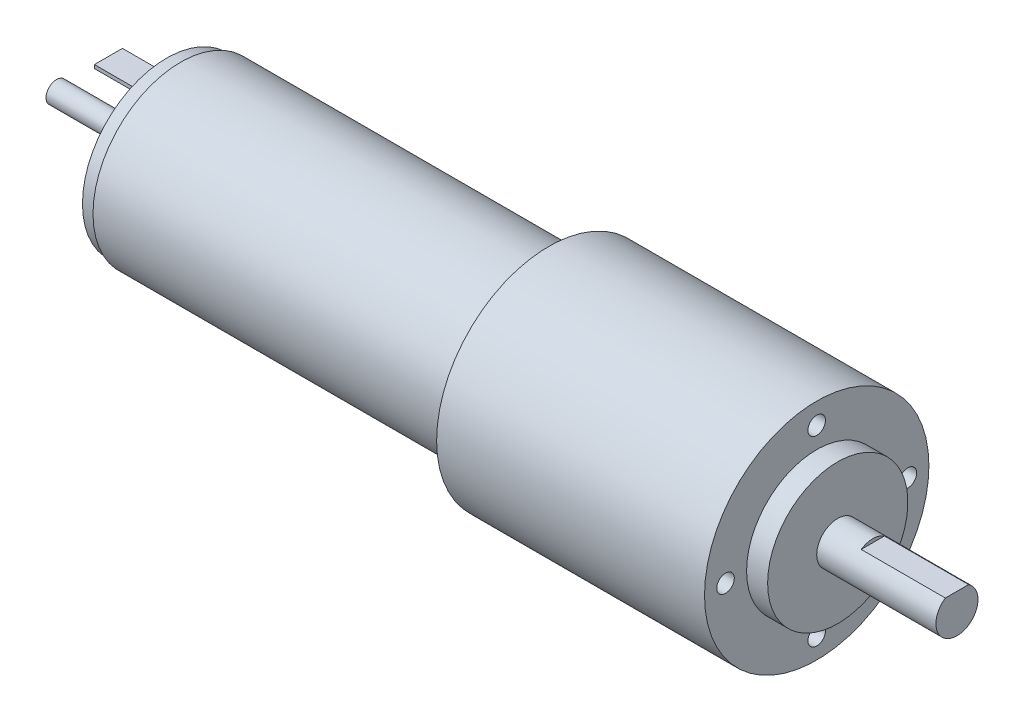
from build123d import *

# Parameters (mm, degrees)
ESQUISSE2_W                  = 4
ESQUISSE2_H                  = 0.5
EXTRUSION1_DEPTH             = 8.3
R_P_TITION_CIRCULAIRE1_COUNT = 2
ENL_V_MAT_EXTRU_1_DEPTH      = 131.378525839
ENL_V_MAT_EXTRU_1_DEPTH_BACK = 131.378525839
ESQUISSE3_W                  = 12
ESQUISSE3_H                  = 0.5


# Read off the part's stored shape, not the designer's step: Répétition circulaire2
with BuildPart() as part:
    # Esquisse1 → Révolution1 (revolve)
    with BuildSketch(Plane.XY, mode=Mode.PRIVATE) as r_volution1_sk:
        Polygon((0, 0), (0, 1.5), (15.7, 1.5), (15.7, 12), (17.7, 12), (17.7, 12.5), (70.2, 12.5), (70.2, 16), (108.4, 16), (108.4, 10), (111.4, 10), (111.4, 3), (128.4, 3), (128.4, 0), align=None)
    revolve(r_volution1_sk.sketch.rotate(Axis((-1000, 0, 0), (1, 0, 0)), 90), axis=Axis((-1000, 0, 0), (1, 0, 0)))

    # Esquisse2 → Extrusion1 (add)
    with BuildSketch(Plane.ZY.offset(-15.7)):
        with Locations((0, -7.8)):
            Rectangle(ESQUISSE2_W, ESQUISSE2_H)
    extrusion1 = extrude(amount=EXTRUSION1_DEPTH)

    # Répétition circulaire1: Extrusion1 ×2 about axis
    r_p_tition_circulaire1_axis = Axis((0, 0, 0), (1, 0, 0))
    for i in range(1, R_P_TITION_CIRCULAIRE1_COUNT):
        add(extrusion1.rotate(r_p_tition_circulaire1_axis, i * 360 / R_P_TITION_CIRCULAIRE1_COUNT))

    # Esquisse3 → Enlèv. mat.-Extru.1 (cut, two sides: drawn at the far end of the back side and taken through both)
    with BuildSketch(Plane.XY.offset(-ENL_V_MAT_EXTRU_1_DEPTH_BACK)):
        with Locations((122.4, 2.75)):
            Rectangle(ESQUISSE3_W, ESQUISSE3_H)
    extrude(amount=ENL_V_MAT_EXTRU_1_DEPTH + ENL_V_MAT_EXTRU_1_DEPTH_BACK, mode=Mode.SUBTRACT)

    # Esquisse5 → Trou taraudé M3x0.51 (revolve, cut)
    with BuildSketch(Plane(origin=(108.4, 13, 0), x_dir=(0, 0, -1), z_dir=(0, 1, 0))):
        Polygon((0, 0), (0, 7.251075774), (1.25, 6.5), (1.25, 0), align=None)
    revolve(axis=Axis((114.75, 13, 0), (-1, 0, 0)), mode=Mode.SUBTRACT)

    # Répétition circulaire2 outline → Répétition circulaire2 (revolve, cut)
    with BuildSketch(Plane.YX.offset(13)):
        Polygon((0, 101.148924226), (1.25, 101.9), (1.25, 108.4), (0, 108.4), align=None)
    revolve(axis=Axis((0, 0, -13), (1, 0, 0)), mode=Mode.SUBTRACT)

    # R_p_tition circulaire2 2 outline → R_p_tition circulaire2 2 (revolve, cut)
    with BuildSketch(Plane(origin=(0, -13, 0), x_dir=(0, 1, 0), z_dir=(0, 0, -1))):
        Polygon((0, 101.148924226), (1.25, 101.9), (1.25, 108.4), (0, 108.4), align=None)
    revolve(axis=Axis((0, -13, 0), (1, 0, 0)), mode=Mode.SUBTRACT)

    # R_p_tition circulaire2 3 outline → R_p_tition circulaire2 3 (revolve, cut)
    with BuildSketch(Plane.YX.offset(-13)):
        Polygon((0, 101.148924226), (1.25, 101.9), (1.25, 108.4), (0, 108.4), align=None)
    revolve(axis=Axis((0, 0, 13), (1, 0, 0)), mode=Mode.SUBTRACT)


solid = part.part
